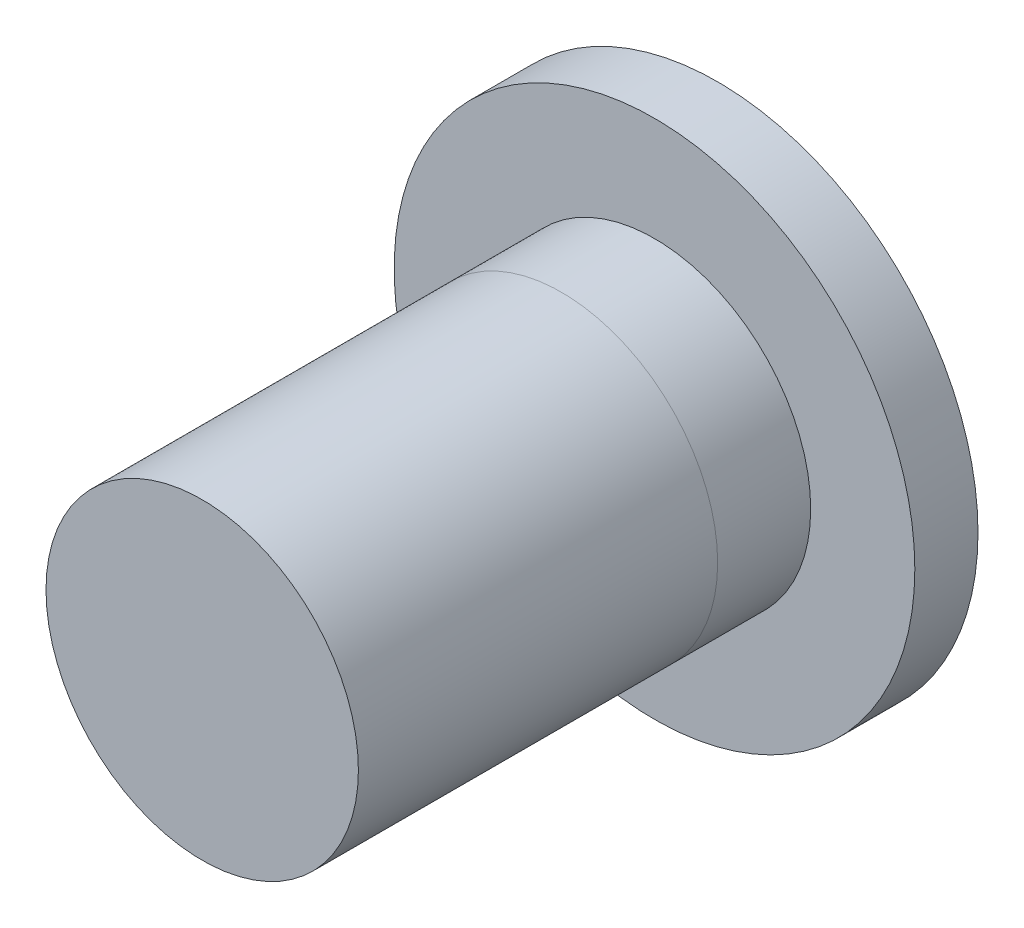
from build123d import *
from OCP.BRepAlgoAPI import BRepAlgoAPI_Cut
from OCP.TopTools import TopTools_ListOfShape

# Parameters (mm, degrees)
SKETCH1_R           = 10
SKETCH1_R_2         = 4.5
BOSS_EXTRUDE1_DEPTH = 2.776375223
SKETCH2_R           = 6
SKETCH2_R_2         = 4.5
BOSS_EXTRUDE3_DEPTH = 3.223625257
SKETCH3_R           = 6
SKETCH3_R_2         = 3.5
BOSS_EXTRUDE4_DEPTH = 3.45
SKETCH4_R           = 6
BOSS_EXTRUDE5_DEPTH = 9.75
SKETCH5_R           = 6
BOSS_EXTRUDE6_DEPTH = 0.6
CUT_EXTRUDE1_START  = -0.35
SKETCH6_R           = 10
SKETCH6_R_2         = 6
CUT_EXTRUDE1_DEPTH  = 0.35


with BuildPart() as part:
    # Sketch1 → Boss-Extrude1 (new body)
    with BuildSketch(Plane.XY.offset(1)):
        with Locations((-18.768000381, 45.999999683)):
            Circle(SKETCH1_R)
        with Locations((-18.768000381, 45.999999683)):
            Circle(SKETCH1_R_2, mode=Mode.SUBTRACT)
    extrude(amount=BOSS_EXTRUDE1_DEPTH)

    # Sketch2 → Boss-Extrude3 (add)
    with BuildSketch(Plane(origin=(-3.3e-07, 0, 3.77637599), x_dir=(0.9999999999999963, 0, 8.742277657347971e-08), z_dir=(-8.742277657347971e-08, -3.821370931908002e-15, 0.9999999999999963))):
        with Locations(Location((-18.76800005, 45.999999683, 0), (0, 0, 180))):
            Circle(SKETCH2_R)
        with Locations((-18.76800005, 45.999999683)):
            Circle(SKETCH2_R_2, mode=Mode.SUBTRACT)
    extrude(amount=BOSS_EXTRUDE3_DEPTH)


with BuildPart() as boss_extrude4_tool:
    # Sketch3 → Boss-Extrude4 (new body)
    with BuildSketch(Plane.XY.offset(7)):
        with Locations((-18.768000662, 45.999999683)):
            Circle(SKETCH3_R)
        with Locations((-18.768000381, 45.999999683)):
            Circle(SKETCH3_R_2, mode=Mode.SUBTRACT)
    extrude(amount=BOSS_EXTRUDE4_DEPTH)


with BuildPart() as part_1:
    add(part.part)


with BuildPart() as part_2:
    # Boss-Extrude4: joined with boss_extrude4_tool
    add(part_1.part.fuse(boss_extrude4_tool.part, tol=0.00001))

    # Sketch4 → Boss-Extrude5 (add)
    with BuildSketch(Plane.XY.offset(10.45)):
        with Locations((-18.768000662, 45.999999683)):
            Circle(SKETCH4_R)
        with BuildLine():
            Line((-17.100629081, 49.07731555), (-17.100628812, 42.922683961))
            ThreePointArc((-17.100628812, 42.922683961), (-22.268000381, 45.99999953), (-17.100629081, 49.07731555))
        make_face(mode=Mode.SUBTRACT)
    extrude(amount=BOSS_EXTRUDE5_DEPTH)

    # Sketch5 → Boss-Extrude6 (add)
    with BuildSketch(Plane.XY.offset(20.2)):
        with Locations((-18.768000662, 45.999999683)):
            Circle(SKETCH5_R)
    extrude(amount=BOSS_EXTRUDE6_DEPTH)


with BuildPart() as cut_extrude1_tool:
    # Sketch6 → Cut-Extrude1 (new body)
    with BuildSketch(Plane(origin=(-3.3e-07, 0, 3.77637599), x_dir=(0.9999999999999963, 0, 8.742277657347971e-08), z_dir=(-8.742277657347971e-08, -3.821370931908002e-15, 0.9999999999999963)).offset(CUT_EXTRUDE1_START)):
        with Locations((-18.76800005, 45.999999683)):
            Circle(SKETCH6_R)
        with Locations((-18.76800005, 45.999999683)):
            Circle(SKETCH6_R_2, mode=Mode.SUBTRACT)
    extrude(amount=CUT_EXTRUDE1_DEPTH)


with BuildPart() as part_3:
    add(part_2.part)

    # Cut-Extrude1: cut by cut_extrude1_tool, with a tolerance
    cut_extrude1_stock = TopTools_ListOfShape()
    cut_extrude1_stock.Append(part_3.part.wrapped)
    cut_extrude1_tools = TopTools_ListOfShape()
    cut_extrude1_tools.Append(cut_extrude1_tool.part.wrapped)
    cut_extrude1_cut = BRepAlgoAPI_Cut()
    cut_extrude1_cut.SetArguments(cut_extrude1_stock)
    cut_extrude1_cut.SetTools(cut_extrude1_tools)
    cut_extrude1_cut.SetFuzzyValue(0.00001)
    cut_extrude1_cut.Build()
    add(Compound.cast(cut_extrude1_cut.Shape()).solids(), mode=Mode.REPLACE)


solid = part_3.part
